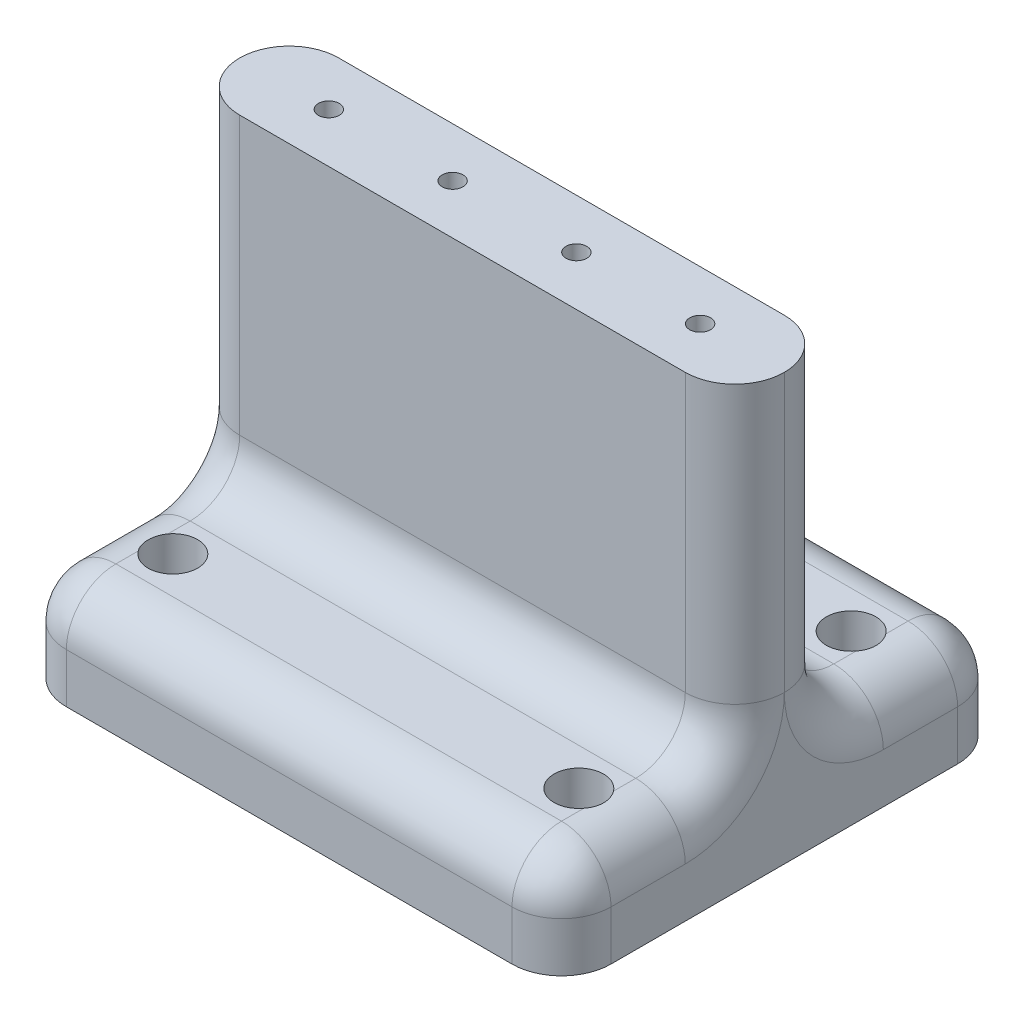
from build123d import *

# Parameters (mm, degrees)
SKETCH2_W           = 110
SKETCH2_H           = 86
BOSS_EXTRUDE1_DEPTH = 20
SKETCH3_W           = 90
SKETCH3_H           = 20
BOSS_EXTRUDE2_DEPTH = 110
SKETCH4_R           = 1.9
CUT_EXTRUDE1_DEPTH  = 20
SKETCH5_R           = 5
CUT_EXTRUDE2_DEPTH  = 10
FILLET1_R           = 10
SKETCH6_R           = 2.1
CUT_EXTRUDE3_DEPTH  = 10


with BuildPart() as part:
    # Sketch2 → Boss-Extrude1 (new body)
    with BuildSketch(Plane.XY):
        with Locations((55, 43)):
            Rectangle(SKETCH2_W, SKETCH2_H)
    extrude(amount=BOSS_EXTRUDE1_DEPTH)

    # Sketch3 → Boss-Extrude2 (add)
    with BuildSketch(Plane(origin=(110, 0, 0), x_dir=(0, 0, -1), z_dir=(1, 0, 0))):
        with Locations((-10, 10)):
            Rectangle(SKETCH3_W, SKETCH3_H)
    extrude(amount=-BOSS_EXTRUDE2_DEPTH)

    # Sketch4 → Cut-Extrude1 (cut)
    with BuildSketch(Plane(origin=(0, 20, 0), x_dir=(1, 0, 0), z_dir=(0, 1, 0))):
        with Locations(Location((14, -37.5, 0), (0, 0, 270))):
            Circle(SKETCH4_R)
        with Locations(Location((96, -37.5, 0), (0, 0, 90))):
            Circle(SKETCH4_R)
        with Locations(Location((96, 17.5, 0), (0, 0, 270))):
            Circle(SKETCH4_R)
        with Locations(Location((14, 17.5, 0), (0, 0, 90))):
            Circle(SKETCH4_R)
    extrude(amount=-CUT_EXTRUDE1_DEPTH, mode=Mode.SUBTRACT)

    # Sketch5 → Cut-Extrude2 (cut)
    with BuildSketch(Plane(origin=(0, 20, 0), x_dir=(1, 0, 0), z_dir=(0, 1, 0))):
        with Locations(Location((96, -37.5, 0), (0, 0, 270))):
            Circle(SKETCH5_R)
        with Locations(Location((14, -37.5, 0), (0, 0, 270))):
            Circle(SKETCH5_R)
        with Locations(Location((14, 17.5, 0), (0, 0, 270))):
            Circle(SKETCH5_R)
        with Locations(Location((96, 17.5, 0), (0, 0, 270))):
            Circle(SKETCH5_R)
    extrude(amount=-CUT_EXTRUDE2_DEPTH, mode=Mode.SUBTRACT)

    # Fillet1
    # the kernel refuses this fillet: 10 mm, written as the material it adds along each edge
    with BuildSketch(Plane(origin=(0, 20, 0), x_dir=(0, 0, -1), z_dir=(1, 0, 0)), Plane(origin=(0, 20, 20), x_dir=(0, 1, 0), z_dir=(1, 0, 0))) as fillet1_piece_1:
        with BuildLine():
            CenterArc((FILLET1_R, FILLET1_R), FILLET1_R, 180, 90)
            Line((0, FILLET1_R), (0, 0))
            Line((0, 0), (FILLET1_R, 0))
        make_face()
    extrude(amount=110)
    # the kernel refuses this fillet: 10 mm, written as the material it takes off along each edge
    with BuildSketch(Plane(origin=(0, 45, -35), x_dir=(0, 0, 1), z_dir=(0, -1, 0)), Plane(origin=(110, 45, -35), x_dir=(-1, 0, 0), z_dir=(0, -1, 0)), Plane(origin=(0, -25, 55), x_dir=(0, 0, -1), z_dir=(0, 1, 0)), Plane(origin=(110, -25, 55), x_dir=(-1, 0, 0), z_dir=(0, 1, 0))) as fillet1_2_piece_1:
        with BuildLine():
            CenterArc((FILLET1_R, -FILLET1_R), FILLET1_R, 90, 90)
            Line((0, -FILLET1_R), (0, 0))
            Line((0, 0), (FILLET1_R, 0))
        make_face()
    extrude(amount=70, mode=Mode.SUBTRACT)
    with BuildSketch(Plane(origin=(135, 20, -35), x_dir=(0, -1, 0), z_dir=(-1, 0, 0))) as fillet1_2_piece_2:
        with BuildLine():
            CenterArc((FILLET1_R, FILLET1_R), FILLET1_R, 180, 90)
            Line((0, FILLET1_R), (0, 0))
            Line((0, 0), (FILLET1_R, 0))
        make_face()
    extrude(amount=160, mode=Mode.SUBTRACT)
    with BuildSketch(Plane(origin=(135, 20, 55), x_dir=(0, -1, 0), z_dir=(-1, 0, 0))) as fillet1_2_piece_3:
        with BuildLine():
            CenterArc((FILLET1_R, -FILLET1_R), FILLET1_R, 90, 90)
            Line((0, -FILLET1_R), (0, 0))
            Line((0, 0), (FILLET1_R, 0))
        make_face()
    extrude(amount=160, mode=Mode.SUBTRACT)
    # the kernel refuses this fillet: 10 mm, written as the material it takes off along each edge
    with BuildSketch(Plane(origin=(100, 10, 45), x_dir=(0, 1, 0), z_dir=(1, 0, 0))) as fillet1_3_piece_1_section:
        Polygon((0, 0), (FILLET1_R, 0), (FILLET1_R, FILLET1_R), (0, FILLET1_R), align=None)
    fillet1_3_piece_1 = extrude(amount=FILLET1_R, mode=Mode.PRIVATE)
    fillet1_3_piece_1 = fillet1_3_piece_1 - Plane(origin=(100, 10, 45), x_dir=(0, -0.7071067811865475, -0.7071067811865475), z_dir=(1, 0, 0)) * Sphere(FILLET1_R, mode=Mode.PRIVATE)
    add(fillet1_3_piece_1, mode=Mode.SUBTRACT)
    with BuildSketch(Plane(origin=(10, 10, 45), x_dir=(0, 1, 0), z_dir=(-1, 0, 0))) as fillet1_3_piece_2_section:
        Polygon((0, 0), (FILLET1_R, 0), (FILLET1_R, -FILLET1_R), (0, -FILLET1_R), align=None)
    fillet1_3_piece_2 = extrude(amount=FILLET1_R, mode=Mode.PRIVATE)
    fillet1_3_piece_2 = fillet1_3_piece_2 - Plane(origin=(10, 10, 45), x_dir=(0, -0.7071067811865475, -0.7071067811865475), z_dir=(-1, 0, 0)) * Sphere(FILLET1_R, mode=Mode.PRIVATE)
    add(fillet1_3_piece_2, mode=Mode.SUBTRACT)
    with BuildSketch(Plane(origin=(10, 10, -25), x_dir=(0, 1, 0), z_dir=(-1, 0, 0))) as fillet1_3_piece_3_section:
        Polygon((0, 0), (FILLET1_R, 0), (FILLET1_R, FILLET1_R), (0, FILLET1_R), align=None)
    fillet1_3_piece_3 = extrude(amount=FILLET1_R, mode=Mode.PRIVATE)
    fillet1_3_piece_3 = fillet1_3_piece_3 - Plane(origin=(10, 10, -25), x_dir=(0, -0.7071067811865475, 0.7071067811865475), z_dir=(-1, 0, 0)) * Sphere(FILLET1_R, mode=Mode.PRIVATE)
    add(fillet1_3_piece_3, mode=Mode.SUBTRACT)
    with BuildSketch(Plane(origin=(100, 10, -25), x_dir=(0, 1, 0), z_dir=(1, 0, 0))) as fillet1_3_piece_4_section:
        Polygon((0, 0), (FILLET1_R, 0), (FILLET1_R, -FILLET1_R), (0, -FILLET1_R), align=None)
    fillet1_3_piece_4 = extrude(amount=FILLET1_R, mode=Mode.PRIVATE)
    fillet1_3_piece_4 = fillet1_3_piece_4 - Plane(origin=(100, 10, -25), x_dir=(0, -0.7071067811865475, 0.7071067811865475), z_dir=(1, 0, 0)) * Sphere(FILLET1_R, mode=Mode.PRIVATE)
    add(fillet1_3_piece_4, mode=Mode.SUBTRACT)
    with BuildSketch(Plane(origin=(0, 111, 0), x_dir=(0, 0, 1), z_dir=(0, -1, 0)), Plane(origin=(110, 30, 0), x_dir=(0, 0, 1), z_dir=(0, 1, 0))) as fillet1_3_piece_5:
        with BuildLine():
            CenterArc((FILLET1_R, -FILLET1_R), FILLET1_R, 90, 90)
            Line((0, -FILLET1_R), (0, 0))
            Line((0, 0), (FILLET1_R, 0))
        make_face()
    extrude(amount=81, mode=Mode.SUBTRACT)
    with BuildSketch(Plane(origin=(0, 111, 20), x_dir=(0, 0, -1), z_dir=(0, -1, 0)), Plane(origin=(110, 30, 20), x_dir=(0, 0, -1), z_dir=(0, 1, 0))) as fillet1_3_piece_6:
        with BuildLine():
            CenterArc((FILLET1_R, FILLET1_R), FILLET1_R, 180, 90)
            Line((0, FILLET1_R), (0, 0))
            Line((0, 0), (FILLET1_R, 0))
        make_face()
    extrude(amount=81, mode=Mode.SUBTRACT)
    with BuildSketch(Plane(origin=(110, 20, -10), x_dir=(0, -1, 0), z_dir=(0, 0, -1)), Plane(origin=(110, 20, 45), x_dir=(0, -1, 0), z_dir=(0, 0, -1))) as fillet1_3_piece_7:
        with BuildLine():
            CenterArc((FILLET1_R, FILLET1_R), FILLET1_R, 180, 90)
            Line((0, FILLET1_R), (0, 0))
            Line((0, 0), (FILLET1_R, 0))
        make_face()
    extrude(amount=15, mode=Mode.SUBTRACT)
    with BuildSketch(Plane(origin=(0, 20, -10), x_dir=(0, -1, 0), z_dir=(0, 0, -1)), Plane(origin=(0, 20, 45), x_dir=(0, -1, 0), z_dir=(0, 0, -1))) as fillet1_3_piece_8:
        with BuildLine():
            CenterArc((FILLET1_R, -FILLET1_R), FILLET1_R, 90, 90)
            Line((0, -FILLET1_R), (0, 0))
            Line((0, 0), (FILLET1_R, 0))
        make_face()
    extrude(amount=15, mode=Mode.SUBTRACT)
    with BuildSketch(Plane(origin=(110, 30, 30), x_dir=(0, 0, -1), z_dir=(0, 1, 0))) as fillet1_3_piece_9:
        with BuildLine():
            CenterArc((10 + FILLET1_R, FILLET1_R), FILLET1_R, 180, 90)
            Line((10, FILLET1_R), (10, 0))
            Line((10, 0), (10 + FILLET1_R, 0))
        make_face()
    revolve(axis=Axis((110, 30, 30), (-1, 0, 0)), revolution_arc=90, mode=Mode.SUBTRACT)
    with BuildSketch(Plane(origin=(0, 30, 30), x_dir=(0, 0, -1), z_dir=(0, 1, 0))) as fillet1_3_piece_10:
        with BuildLine():
            CenterArc((10 + FILLET1_R, -FILLET1_R), FILLET1_R, 90, 90)
            Line((10, -FILLET1_R), (10, 0))
            Line((10, 0), (10 + FILLET1_R, 0))
        make_face()
    revolve(axis=Axis((0, 30, 30), (-1, 0, 0)), revolution_arc=90, mode=Mode.SUBTRACT)
    with BuildSketch(Plane(origin=(0, 30, -10), x_dir=(0, -1, 0), z_dir=(0, 0, -1))) as fillet1_3_piece_11:
        with BuildLine():
            CenterArc((10 + FILLET1_R, -FILLET1_R), FILLET1_R, 90, 90)
            Line((10, -FILLET1_R), (10, 0))
            Line((10, 0), (10 + FILLET1_R, 0))
        make_face()
    revolve(axis=Axis((0, 30, -10), (-1, 0, 0)), revolution_arc=90, mode=Mode.SUBTRACT)
    with BuildSketch(Plane(origin=(110, 30, -10), x_dir=(0, -1, 0), z_dir=(0, 0, -1))) as fillet1_3_piece_12:
        with BuildLine():
            CenterArc((10 + FILLET1_R, FILLET1_R), FILLET1_R, 180, 90)
            Line((10, FILLET1_R), (10, 0))
            Line((10, 0), (10 + FILLET1_R, 0))
        make_face()
    revolve(axis=Axis((110, 30, -10), (-1, 0, 0)), revolution_arc=90, mode=Mode.SUBTRACT)

    # Sketch6 → Cut-Extrude3 (cut)
    with BuildSketch(Plane(origin=(0, 86, 0), x_dir=(1, 0, 0), z_dir=(0, 1, 0))):
        with Locations(Location((18, -10, 0), (0, 0, 270))):
            Circle(SKETCH6_R)
        with Locations(Location((43, -10, 0), (0, 0, 270))):
            Circle(SKETCH6_R)
        with Locations(Location((68, -10, 0), (0, 0, 270))):
            Circle(SKETCH6_R)
        with Locations(Location((93, -10, 0), (0, 0, 270))):
            Circle(SKETCH6_R)
    extrude(amount=-CUT_EXTRUDE3_DEPTH, mode=Mode.SUBTRACT)


solid = part.part
